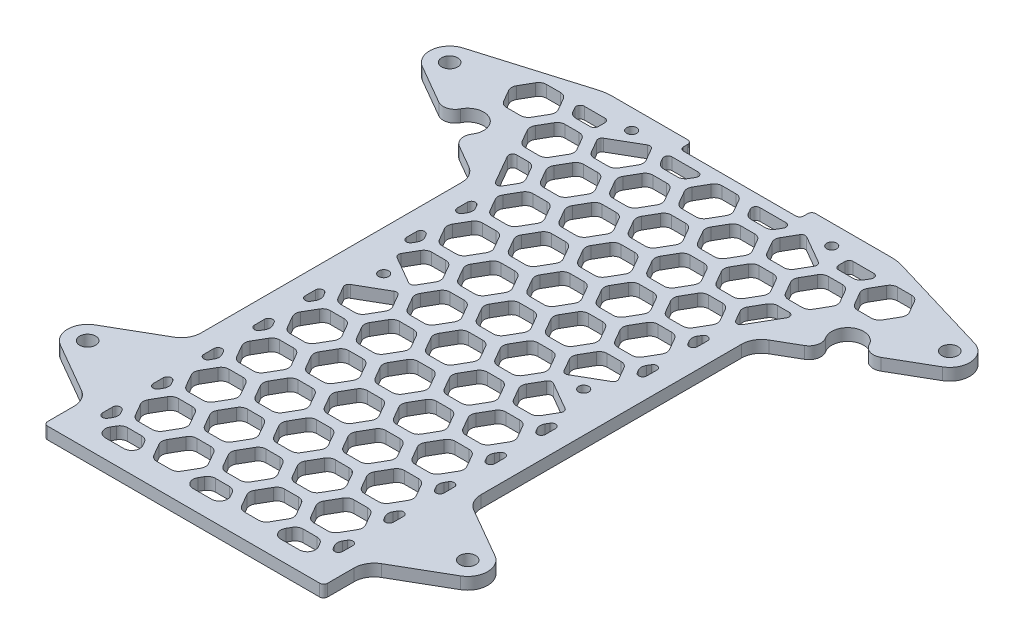
from build123d import *

# Parameters (mm, degrees)
SKETCH_2_R          = 1.25
SKETCH_2_R_2        = 2
EXTRUDE_1_DEPTH     = 3
SKETCH_5_W          = 30
SKETCH_5_H          = 3
CUT_EXTRUDE_4_DEPTH = 153.755523632
FILLET_2_R          = 1
FILLET_1_R          = 2


with BuildPart() as part:
    # 草图2 → 凸台-拉伸1 (new body)
    with BuildSketch(Plane(origin=(0, 0, 0), x_dir=(1, 0, 0), z_dir=(0, 1, 0))):
        with BuildLine():
            Line((-43.151430903, -24.944404268), (-37.5, -28.207259422))
            ThreePointArc((-37.5, -28.207259422), (-35.669872981, -30.037386441), (-35, -32.537386441))
            Line((-35, -32.537386441), (-35, -97.622867597))
            ThreePointArc((-35, -97.622867597), (-35.669872981, -100.122867597), (-37.5, -101.952994616))
            Line((-37.5, -101.952994616), (-50, -109.169872981))
            ThreePointArc((-50, -109.169872981), (-52.5, -113.5), (-50, -117.830127019))
            Line((-50, -117.830127019), (-37.5, -125.047005384))
            ThreePointArc((-37.5, -125.047005384), (-35.669872981, -126.877132403), (-35, -129.377132403))
            Line((-35, -129.377132403), (-35, -137))
            Line((-35, -137), (35, -137))
            Line((35, -137), (35, -129.377132403))
            ThreePointArc((35, -129.377132403), (35.669872981, -126.877132403), (37.5, -125.047005384))
            Line((37.5, -125.047005384), (50, -117.830127019))
            ThreePointArc((50, -117.830127019), (52.5, -113.5), (50, -109.169872981))
            Line((50, -109.169872981), (37.5, -101.952994616))
            ThreePointArc((37.5, -101.952994616), (35.669872981, -100.122867597), (35, -97.622867597))
            Line((35, -97.622867597), (35, -32.537386441))
            ThreePointArc((35, -32.537386441), (35.669872981, -30.037386441), (37.5, -28.207259422))
            Line((37.5, -28.207259422), (43.151430903, -24.944404268))
            ThreePointArc((43.151430903, -24.944404268), (44.570551627, -23.038234264), (44.157960516, -20.697901747))
            ThreePointArc((44.157960516, -20.697901747), (45.5, -15.035898385), (51.07445849, -16.70465978))
            ThreePointArc((51.07445849, -16.70465978), (52.894950347, -18.232140422), (55.255302357, -17.956230826))
            Line((55.255302357, -17.956230826), (65, -12.330127019))
            ThreePointArc((65, -12.330127019), (67.466051679, -7.418337963), (63.931706025, -3.209361435))
            Line((63.931706025, -3.209361435), (37.86341205, 4.581277129))
            ThreePointArc((37.86341205, 4.581277129), (36.44693274, 4.894765568), (35, 5))
            Line((35, 5), (-35, 5))
            ThreePointArc((-35, 5), (-36.44693274, 4.894765568), (-37.86341205, 4.581277129))
            Line((-37.86341205, 4.581277129), (-63.931706025, -3.209361435))
            ThreePointArc((-63.931706025, -3.209361435), (-67.466051679, -7.418337963), (-65, -12.330127019))
            Line((-65, -12.330127019), (-55.255302357, -17.956230826))
            ThreePointArc((-55.255302357, -17.956230826), (-52.894950347, -18.232140422), (-51.07445849, -16.70465978))
            ThreePointArc((-51.07445849, -16.70465978), (-45.5, -15.035898385), (-44.157960516, -20.697901747))
            ThreePointArc((-44.157960516, -20.697901747), (-44.570551627, -23.038234264), (-43.151430903, -24.944404268))
        make_face()
        with Locations(Location((-25, 0, 0), (0, 0, 270))):
            Circle(SKETCH_2_R, mode=Mode.SUBTRACT)
        with Locations(Location((-62.5, -8, 0), (0, 0, 270))):
            Circle(SKETCH_2_R_2, mode=Mode.SUBTRACT)
        with Locations(Location((62.5, -8, 0), (0, 0, 90))):
            Circle(SKETCH_2_R_2, mode=Mode.SUBTRACT)
        with Locations(Location((25, 0, 0), (0, 0, 270))):
            Circle(SKETCH_2_R, mode=Mode.SUBTRACT)
        with Locations(Location((-25, -62, 0), (0, 0, 270))):
            Circle(SKETCH_2_R, mode=Mode.SUBTRACT)
        with Locations(Location((25, -62, 0), (0, 0, 270))):
            Circle(SKETCH_2_R, mode=Mode.SUBTRACT)
        with Locations(Location((-47.5, -113.5, 0), (0, 0, 270))):
            Circle(SKETCH_2_R_2, mode=Mode.SUBTRACT)
        with Locations(Location((47.5, -113.5, 0), (0, 0, 90))):
            Circle(SKETCH_2_R_2, mode=Mode.SUBTRACT)
    extrude(amount=EXTRUDE_1_DEPTH)

    # 草图5 → 切除-拉伸4 (cut, through all)
    with BuildSketch(Plane(origin=(0, 3, 0), x_dir=(1, 0, 0), z_dir=(0, 1, 0))):
        Polygon((-19.052558883, -13.333333333), (-24.826061575, -13.333333333), (-27.712812921, -18.333333333), (-24.826061575, -23.333333333), (-19.052558883, -23.333333333), (-16.165807537, -18.333333333), align=None)
        Polygon((-30.022213998, -19.666666667), (-35.79571669, -19.666666667), (-30.022213998, -29.666666667), (-27.135462652, -24.666666667), align=None)
        with Locations((0, 3.5)):
            Rectangle(SKETCH_5_W, SKETCH_5_H)
        Polygon((2.886751346, -13.333333333), (-2.886751346, -13.333333333), (-5.773502692, -18.333333333), (-2.886751346, -23.333333333), (2.886751346, -23.333333333), (5.773502692, -18.333333333), align=None)
        Polygon((-8.082903769, -19.666666667), (-13.856406461, -19.666666667), (-16.743157806, -24.666666667), (-13.856406461, -29.666666667), (-8.082903769, -29.666666667), (-5.196152423, -24.666666667), align=None)
        Polygon((-8.082903769, -7), (-13.856406461, -7), (-16.743157806, -12), (-13.856406461, -17), (-8.082903769, -17), (-5.196152423, -12), align=None)
        Polygon((2.886751346, -0.666666667), (-2.886751346, -0.666666667), (-5.773502692, -5.666666667), (-2.886751346, -10.666666667), (2.886751346, -10.666666667), (5.773502692, -5.666666667), align=None)
        Polygon((-30.022213998, -7), (-35.79571669, -7), (-38.682468036, -12), (-35.79571669, -17), (-30.022213998, -17), (-27.135462652, -12), align=None)
        Polygon((-27.712812921, -5.666666667), (-24.826061575, -10.666666667), (-19.052558883, -10.666666667), (-16.165807537, -5.666666667), (-19.052558883, -0.666666667), align=None)
        Polygon((-40.991869112, -0.666666667), (-46.765371804, -0.666666667), (-49.65212315, -5.666666667), (-46.765371804, -10.666666667), (-40.991869112, -10.666666667), (-38.105117767, -5.666666667), align=None)
        Polygon((-19.052558883, -38.666666667), (-24.826061575, -38.666666667), (-27.712812921, -43.666666667), (-24.826061575, -48.666666667), (-19.052558883, -48.666666667), (-16.165807537, -43.666666667), align=None)
        Polygon((-30.022213998, -55), (-27.135462652, -50), (-30.022213998, -45), align=None)
        Polygon((-30.022213998, -42.333333333), (-27.135462652, -37.333333333), (-30.022213998, -32.333333333), align=None)
        Polygon((-19.052558883, -26), (-24.826061575, -26), (-27.712812921, -31), (-24.826061575, -36), (-19.052558883, -36), (-16.165807537, -31), align=None)
        Polygon((-27.712812921, -69), (-24.826061575, -74), (-19.052558883, -74), (-16.165807537, -69), (-19.052558883, -64), align=None)
        Polygon((-30.022213998, -80.333333333), (-27.135462652, -75.333333333), (-30.022213998, -70.333333333), align=None)
        Polygon((-19.052558883, -51.333333333), (-24.826061575, -51.333333333), (-27.712812921, -56.333333333), (-19.052558883, -61.333333333), (-16.165807537, -56.333333333), align=None)
        Polygon((-19.052558883, -89.333333333), (-24.826061575, -89.333333333), (-27.712812921, -94.333333333), (-24.826061575, -99.333333333), (-19.052558883, -99.333333333), (-16.165807537, -94.333333333), align=None)
        Polygon((-30.022213998, -105.666666667), (-27.135462652, -100.666666667), (-30.022213998, -95.666666667), align=None)
        Polygon((-30.022213998, -93), (-27.135462652, -88), (-30.022213998, -83), align=None)
        Polygon((-19.052558883, -76.666666667), (-24.826061575, -76.666666667), (-27.712812921, -81.666666667), (-24.826061575, -86.666666667), (-19.052558883, -86.666666667), (-16.165807537, -81.666666667), align=None)
        Polygon((-19.052558883, -114.666666667), (-24.826061575, -114.666666667), (-27.712812921, -119.666666667), (-24.826061575, -124.666666667), (-19.052558883, -124.666666667), (-16.165807537, -119.666666667), align=None)
        Polygon((-30.022213998, -131), (-27.135462652, -126), (-30.022213998, -121), align=None)
        Polygon((-30.022213998, -118.333333333), (-27.135462652, -113.333333333), (-30.022213998, -108.333333333), align=None)
        Polygon((-19.052558883, -102), (-24.826061575, -102), (-27.712812921, -107), (-24.826061575, -112), (-19.052558883, -112), (-16.165807537, -107), align=None)
        Polygon((-19.052558883, -127.333333333), (-24.826061575, -127.333333333), (-27.712812921, -132.333333333), (-16.165807537, -132.333333333), align=None)
        Polygon((2.886751346, -38.666666667), (-2.886751346, -38.666666667), (-5.773502692, -43.666666667), (-2.886751346, -48.666666667), (2.886751346, -48.666666667), (5.773502692, -43.666666667), align=None)
        Polygon((-8.082903769, -45), (-13.856406461, -45), (-16.743157806, -50), (-13.856406461, -55), (-8.082903769, -55), (-5.196152423, -50), align=None)
        Polygon((-8.082903769, -32.333333333), (-13.856406461, -32.333333333), (-16.743157806, -37.333333333), (-13.856406461, -42.333333333), (-8.082903769, -42.333333333), (-5.196152423, -37.333333333), align=None)
        Polygon((2.886751346, -26), (-2.886751346, -26), (-5.773502692, -31), (-2.886751346, -36), (2.886751346, -36), (5.773502692, -31), align=None)
        Polygon((2.886751346, -64), (-2.886751346, -64), (-5.773502692, -69), (-2.886751346, -74), (2.886751346, -74), (5.773502692, -69), align=None)
        Polygon((-8.082903769, -70.333333333), (-13.856406461, -70.333333333), (-16.743157806, -75.333333333), (-13.856406461, -80.333333333), (-8.082903769, -80.333333333), (-5.196152423, -75.333333333), align=None)
        Polygon((-8.082903769, -57.666666667), (-13.856406461, -57.666666667), (-16.743157806, -62.666666667), (-13.856406461, -67.666666667), (-8.082903769, -67.666666667), (-5.196152423, -62.666666667), align=None)
        Polygon((2.886751346, -51.333333333), (-2.886751346, -51.333333333), (-5.773502692, -56.333333333), (-2.886751346, -61.333333333), (2.886751346, -61.333333333), (5.773502692, -56.333333333), align=None)
        Polygon((2.886751346, -89.333333333), (-2.886751346, -89.333333333), (-5.773502692, -94.333333333), (-2.886751346, -99.333333333), (2.886751346, -99.333333333), (5.773502692, -94.333333333), align=None)
        Polygon((-8.082903769, -95.666666667), (-13.856406461, -95.666666667), (-16.743157806, -100.666666667), (-13.856406461, -105.666666667), (-8.082903769, -105.666666667), (-5.196152423, -100.666666667), align=None)
        Polygon((-8.082903769, -83), (-13.856406461, -83), (-16.743157806, -88), (-13.856406461, -93), (-8.082903769, -93), (-5.196152423, -88), align=None)
        Polygon((2.886751346, -76.666666667), (-2.886751346, -76.666666667), (-5.773502692, -81.666666667), (-2.886751346, -86.666666667), (2.886751346, -86.666666667), (5.773502692, -81.666666667), align=None)
        Polygon((2.886751346, -114.666666667), (-2.886751346, -114.666666667), (-5.773502692, -119.666666667), (-2.886751346, -124.666666667), (2.886751346, -124.666666667), (5.773502692, -119.666666667), align=None)
        Polygon((-8.082903769, -121), (-13.856406461, -121), (-16.743157806, -126), (-13.856406461, -131), (-8.082903769, -131), (-5.196152423, -126), align=None)
        Polygon((-8.082903769, -108.333333333), (-13.856406461, -108.333333333), (-16.743157806, -113.333333333), (-13.856406461, -118.333333333), (-8.082903769, -118.333333333), (-5.196152423, -113.333333333), align=None)
        Polygon((2.886751346, -102), (-2.886751346, -102), (-5.773502692, -107), (-2.886751346, -112), (2.886751346, -112), (5.773502692, -107), align=None)
        Polygon((2.886751346, -127.333333333), (-2.886751346, -127.333333333), (-5.773502692, -132.333333333), (5.773502692, -132.333333333), align=None)
        Polygon((-15.973357448, -0.666666667), (-13.856406461, -4.333333333), (-8.082903769, -4.333333333), (-5.965952782, -0.666666667), align=None)
        Polygon((-37.912667677, -0.666666667), (-30.022213998, -0.666666667), (-30.022213998, -4.333333333), (-35.79571669, -4.333333333), align=None)
    cut_extrude_4 = extrude(amount=-CUT_EXTRUDE_4_DEPTH, mode=Mode.SUBTRACT)

    # 镜向1: 切除-拉伸4 across plane
    add(cut_extrude_4.mirror(Plane(origin=(0, 0, 0), x_dir=(0, 0, 1), z_dir=(1, 0, 0))), mode=Mode.SUBTRACT)

    # 圆角2
    fillet_2_edges = [part.edges().sort_by_distance(p)[0] for p in [
        (30.022213998, 1.5, 121),
        (30.022213998, 1.5, 131),
        (30.022213998, 1.5, 83),
        (30.022213998, 1.5, 93),
        (30.022213998, 1.5, 95.666666667),
        (30.022213998, 1.5, 105.666666667),
        (27.712812921, 1.5, 56.333333333),
        (19.052558883, 1.5, 61.333333333),
        (30.022213998, 1.5, 70.333333333),
        (30.022213998, 1.5, 80.333333333),
        (30.022213998, 1.5, 108.333333333),
        (30.022213998, 1.5, 118.333333333),
        (35.79571669, 1.5, 19.666666667),
        (30.022213998, 1.5, 29.666666667),
        (30.022213998, 1.5, 45),
        (30.022213998, 1.5, 55),
        (30.022213998, 1.5, 32.333333333),
        (30.022213998, 1.5, 42.333333333),
        (19.052558883, 1.5, 64),
        (27.712812921, 1.5, 69),
        (19.052558883, 1.5, 0.666666667),
        (27.712812921, 1.5, 5.666666667),
        (37.912667677, 1.5, 0.666666667),
        (30.022213998, 1.5, 4.333333333),
        (30.022213998, 1.5, 0.666666667),
        (5.965952782, 1.5, 0.666666667),
        (15.973357448, 1.5, 0.666666667),
        (-30.022213998, 1.5, 131),
        (-30.022213998, 1.5, 121),
        (-30.022213998, 1.5, 93),
        (-30.022213998, 1.5, 83),
        (-30.022213998, 1.5, 105.666666667),
        (-30.022213998, 1.5, 95.666666667),
        (-19.052558883, 1.5, 61.333333333),
        (-27.712812921, 1.5, 56.333333333),
        (-30.022213998, 1.5, 80.333333333),
        (-30.022213998, 1.5, 70.333333333),
        (-30.022213998, 1.5, 118.333333333),
        (-30.022213998, 1.5, 108.333333333),
        (-30.022213998, 1.5, 29.666666667),
        (-35.79571669, 1.5, 19.666666667),
        (-15, 1.5, -2),
        (-15, 1.5, -5),
        (15, 1.5, -5),
        (15, 1.5, -2),
        (-30.022213998, 1.5, 55),
        (-30.022213998, 1.5, 45),
        (-30.022213998, 1.5, 42.333333333),
        (-30.022213998, 1.5, 32.333333333),
        (35, 1.5, 137),
        (-27.712812921, 1.5, 69),
        (-19.052558883, 1.5, 64),
        (-35, 1.5, 137),
        (-27.712812921, 1.5, 5.666666667),
        (-19.052558883, 1.5, 0.666666667),
        (-37.912667677, 1.5, 0.666666667),
        (-30.022213998, 1.5, 0.666666667),
        (-30.022213998, 1.5, 4.333333333),
        (-15.973357448, 1.5, 0.666666667),
        (-5.965952782, 1.5, 0.666666667),
    ]]
    fillet(fillet_2_edges, radius=FILLET_2_R)

    # 圆角1
    fillet_1_edges = [part.edges().sort_by_distance(p)[0] for p in [
        (16.165807537, 1.5, 119.666666667),
        (19.052558883, 1.5, 114.666666667),
        (24.826061575, 1.5, 114.666666667),
        (27.712812921, 1.5, 119.666666667),
        (24.826061575, 1.5, 124.666666667),
        (19.052558883, 1.5, 124.666666667),
        (27.135462652, 1.5, 126),
        (27.135462652, 1.5, 88),
        (16.165807537, 1.5, 81.666666667),
        (19.052558883, 1.5, 76.666666667),
        (24.826061575, 1.5, 76.666666667),
        (27.712812921, 1.5, 81.666666667),
        (24.826061575, 1.5, 86.666666667),
        (19.052558883, 1.5, 86.666666667),
        (16.165807537, 1.5, 94.333333333),
        (19.052558883, 1.5, 89.333333333),
        (24.826061575, 1.5, 89.333333333),
        (27.712812921, 1.5, 94.333333333),
        (24.826061575, 1.5, 99.333333333),
        (19.052558883, 1.5, 99.333333333),
        (27.135462652, 1.5, 100.666666667),
        (16.165807537, 1.5, 56.333333333),
        (19.052558883, 1.5, 51.333333333),
        (24.826061575, 1.5, 51.333333333),
        (27.135462652, 1.5, 75.333333333),
        (5.196152423, 1.5, 50),
        (8.082903769, 1.5, 45),
        (13.856406461, 1.5, 45),
        (16.743157806, 1.5, 50),
        (13.856406461, 1.5, 55),
        (8.082903769, 1.5, 55),
        (5.196152423, 1.5, 37.333333333),
        (8.082903769, 1.5, 32.333333333),
        (13.856406461, 1.5, 32.333333333),
        (16.743157806, 1.5, 37.333333333),
        (13.856406461, 1.5, 42.333333333),
        (8.082903769, 1.5, 42.333333333),
        (16.165807537, 1.5, 107),
        (19.052558883, 1.5, 102),
        (24.826061575, 1.5, 102),
        (27.712812921, 1.5, 107),
        (24.826061575, 1.5, 112),
        (19.052558883, 1.5, 112),
        (27.135462652, 1.5, 113.333333333),
        (16.165807537, 1.5, 132.333333333),
        (19.052558883, 1.5, 127.333333333),
        (24.826061575, 1.5, 127.333333333),
        (27.712812921, 1.5, 132.333333333),
        (27.135462652, 1.5, 12),
        (30.022213998, 1.5, 7),
        (35.79571669, 1.5, 7),
        (38.682468036, 1.5, 12),
        (35.79571669, 1.5, 17),
        (30.022213998, 1.5, 17),
        (27.135462652, 1.5, 24.666666667),
        (30.022213998, 1.5, 19.666666667),
        (5.196152423, 1.5, 12),
        (8.082903769, 1.5, 7),
        (13.856406461, 1.5, 7),
        (16.743157806, 1.5, 12),
        (13.856406461, 1.5, 17),
        (8.082903769, 1.5, 17),
        (16.165807537, 1.5, 18.333333333),
        (19.052558883, 1.5, 13.333333333),
        (24.826061575, 1.5, 13.333333333),
        (27.712812921, 1.5, 18.333333333),
        (24.826061575, 1.5, 23.333333333),
        (19.052558883, 1.5, 23.333333333),
        (5.196152423, 1.5, 24.666666667),
        (8.082903769, 1.5, 19.666666667),
        (13.856406461, 1.5, 19.666666667),
        (16.743157806, 1.5, 24.666666667),
        (13.856406461, 1.5, 29.666666667),
        (8.082903769, 1.5, 29.666666667),
        (27.135462652, 1.5, 50),
        (27.135462652, 1.5, 37.333333333),
        (16.165807537, 1.5, 31),
        (19.052558883, 1.5, 26),
        (24.826061575, 1.5, 26),
        (27.712812921, 1.5, 31),
        (24.826061575, 1.5, 36),
        (19.052558883, 1.5, 36),
        (24.826061575, 1.5, 74),
        (19.052558883, 1.5, 74),
        (16.165807537, 1.5, 69),
        (24.826061575, 1.5, 10.666666667),
        (19.052558883, 1.5, 10.666666667),
        (16.165807537, 1.5, 5.666666667),
        (35.79571669, 1.5, 4.333333333),
        (38.105117767, 1.5, 5.666666667),
        (40.991869112, 1.5, 0.666666667),
        (46.765371804, 1.5, 0.666666667),
        (49.65212315, 1.5, 5.666666667),
        (46.765371804, 1.5, 10.666666667),
        (40.991869112, 1.5, 10.666666667),
        (16.165807537, 1.5, 43.666666667),
        (19.052558883, 1.5, 38.666666667),
        (24.826061575, 1.5, 38.666666667),
        (27.712812921, 1.5, 43.666666667),
        (24.826061575, 1.5, 48.666666667),
        (19.052558883, 1.5, 48.666666667),
        (5.196152423, 1.5, 126),
        (8.082903769, 1.5, 121),
        (13.856406461, 1.5, 121),
        (16.743157806, 1.5, 126),
        (13.856406461, 1.5, 131),
        (8.082903769, 1.5, 131),
        (5.196152423, 1.5, 113.333333333),
        (8.082903769, 1.5, 108.333333333),
        (13.856406461, 1.5, 108.333333333),
        (16.743157806, 1.5, 113.333333333),
        (13.856406461, 1.5, 118.333333333),
        (8.082903769, 1.5, 118.333333333),
        (5.196152423, 1.5, 62.666666667),
        (8.082903769, 1.5, 57.666666667),
        (13.856406461, 1.5, 57.666666667),
        (16.743157806, 1.5, 62.666666667),
        (13.856406461, 1.5, 67.666666667),
        (8.082903769, 1.5, 67.666666667),
        (5.196152423, 1.5, 75.333333333),
        (8.082903769, 1.5, 70.333333333),
        (13.856406461, 1.5, 70.333333333),
        (16.743157806, 1.5, 75.333333333),
        (13.856406461, 1.5, 80.333333333),
        (8.082903769, 1.5, 80.333333333),
        (5.196152423, 1.5, 88),
        (8.082903769, 1.5, 83),
        (13.856406461, 1.5, 83),
        (16.743157806, 1.5, 88),
        (13.856406461, 1.5, 93),
        (8.082903769, 1.5, 93),
        (5.196152423, 1.5, 100.666666667),
        (8.082903769, 1.5, 95.666666667),
        (13.856406461, 1.5, 95.666666667),
        (16.743157806, 1.5, 100.666666667),
        (13.856406461, 1.5, 105.666666667),
        (8.082903769, 1.5, 105.666666667),
        (13.856406461, 1.5, 4.333333333),
        (8.082903769, 1.5, 4.333333333),
        (-19.052558883, 1.5, 114.666666667),
        (-16.165807537, 1.5, 119.666666667),
        (-19.052558883, 1.5, 124.666666667),
        (-24.826061575, 1.5, 124.666666667),
        (-27.712812921, 1.5, 119.666666667),
        (-24.826061575, 1.5, 114.666666667),
        (-27.135462652, 1.5, 126),
        (-27.135462652, 1.5, 88),
        (-19.052558883, 1.5, 76.666666667),
        (-16.165807537, 1.5, 81.666666667),
        (-19.052558883, 1.5, 86.666666667),
        (-24.826061575, 1.5, 86.666666667),
        (-27.712812921, 1.5, 81.666666667),
        (-24.826061575, 1.5, 76.666666667),
        (-19.052558883, 1.5, 89.333333333),
        (-16.165807537, 1.5, 94.333333333),
        (-19.052558883, 1.5, 99.333333333),
        (-24.826061575, 1.5, 99.333333333),
        (-27.712812921, 1.5, 94.333333333),
        (-24.826061575, 1.5, 89.333333333),
        (-27.135462652, 1.5, 100.666666667),
        (-19.052558883, 1.5, 51.333333333),
        (-16.165807537, 1.5, 56.333333333),
        (-24.826061575, 1.5, 51.333333333),
        (-27.135462652, 1.5, 75.333333333),
        (-8.082903769, 1.5, 45),
        (-5.196152423, 1.5, 50),
        (-8.082903769, 1.5, 55),
        (-13.856406461, 1.5, 55),
        (-16.743157806, 1.5, 50),
        (-13.856406461, 1.5, 45),
        (-8.082903769, 1.5, 32.333333333),
        (-5.196152423, 1.5, 37.333333333),
        (-8.082903769, 1.5, 42.333333333),
        (-13.856406461, 1.5, 42.333333333),
        (-16.743157806, 1.5, 37.333333333),
        (-13.856406461, 1.5, 32.333333333),
        (2.886751346, 1.5, 26),
        (5.773502692, 1.5, 31),
        (2.886751346, 1.5, 36),
        (-2.886751346, 1.5, 36),
        (-5.773502692, 1.5, 31),
        (-2.886751346, 1.5, 26),
        (2.886751346, 1.5, 64),
        (5.773502692, 1.5, 69),
        (2.886751346, 1.5, 74),
        (-2.886751346, 1.5, 74),
        (-5.773502692, 1.5, 69),
        (-2.886751346, 1.5, 64),
        (-19.052558883, 1.5, 102),
        (-16.165807537, 1.5, 107),
        (-19.052558883, 1.5, 112),
        (-24.826061575, 1.5, 112),
        (-27.712812921, 1.5, 107),
        (-24.826061575, 1.5, 102),
        (-27.135462652, 1.5, 113.333333333),
        (-19.052558883, 1.5, 127.333333333),
        (-16.165807537, 1.5, 132.333333333),
        (-27.712812921, 1.5, 132.333333333),
        (-24.826061575, 1.5, 127.333333333),
        (2.886751346, 1.5, 38.666666667),
        (5.773502692, 1.5, 43.666666667),
        (2.886751346, 1.5, 48.666666667),
        (-2.886751346, 1.5, 48.666666667),
        (-5.773502692, 1.5, 43.666666667),
        (-2.886751346, 1.5, 38.666666667),
        (-30.022213998, 1.5, 7),
        (-27.135462652, 1.5, 12),
        (-30.022213998, 1.5, 17),
        (-35.79571669, 1.5, 17),
        (-38.682468036, 1.5, 12),
        (-35.79571669, 1.5, 7),
        (-30.022213998, 1.5, 19.666666667),
        (-27.135462652, 1.5, 24.666666667),
        (-8.082903769, 1.5, 7),
        (-5.196152423, 1.5, 12),
        (-8.082903769, 1.5, 17),
        (-13.856406461, 1.5, 17),
        (-16.743157806, 1.5, 12),
        (-13.856406461, 1.5, 7),
        (2.886751346, 1.5, 0.666666667),
        (5.773502692, 1.5, 5.666666667),
        (2.886751346, 1.5, 10.666666667),
        (-2.886751346, 1.5, 10.666666667),
        (-5.773502692, 1.5, 5.666666667),
        (-2.886751346, 1.5, 0.666666667),
        (-19.052558883, 1.5, 13.333333333),
        (-16.165807537, 1.5, 18.333333333),
        (-19.052558883, 1.5, 23.333333333),
        (-24.826061575, 1.5, 23.333333333),
        (-27.712812921, 1.5, 18.333333333),
        (-24.826061575, 1.5, 13.333333333),
        (-8.082903769, 1.5, 19.666666667),
        (-5.196152423, 1.5, 24.666666667),
        (-8.082903769, 1.5, 29.666666667),
        (-13.856406461, 1.5, 29.666666667),
        (-16.743157806, 1.5, 24.666666667),
        (-13.856406461, 1.5, 19.666666667),
        (2.886751346, 1.5, 13.333333333),
        (5.773502692, 1.5, 18.333333333),
        (2.886751346, 1.5, 23.333333333),
        (-2.886751346, 1.5, 23.333333333),
        (-5.773502692, 1.5, 18.333333333),
        (-2.886751346, 1.5, 13.333333333),
        (-27.135462652, 1.5, 50),
        (-27.135462652, 1.5, 37.333333333),
        (-19.052558883, 1.5, 26),
        (-16.165807537, 1.5, 31),
        (-19.052558883, 1.5, 36),
        (-24.826061575, 1.5, 36),
        (-27.712812921, 1.5, 31),
        (-24.826061575, 1.5, 26),
        (-16.165807537, 1.5, 69),
        (-19.052558883, 1.5, 74),
        (-24.826061575, 1.5, 74),
        (-16.165807537, 1.5, 5.666666667),
        (-19.052558883, 1.5, 10.666666667),
        (-24.826061575, 1.5, 10.666666667),
        (-35.79571669, 1.5, 4.333333333),
        (-40.991869112, 1.5, 0.666666667),
        (-38.105117767, 1.5, 5.666666667),
        (-40.991869112, 1.5, 10.666666667),
        (-46.765371804, 1.5, 10.666666667),
        (-49.65212315, 1.5, 5.666666667),
        (-46.765371804, 1.5, 0.666666667),
        (-19.052558883, 1.5, 38.666666667),
        (-16.165807537, 1.5, 43.666666667),
        (-19.052558883, 1.5, 48.666666667),
        (-24.826061575, 1.5, 48.666666667),
        (-27.712812921, 1.5, 43.666666667),
        (-24.826061575, 1.5, 38.666666667),
        (-8.082903769, 1.5, 121),
        (-5.196152423, 1.5, 126),
        (-8.082903769, 1.5, 131),
        (-13.856406461, 1.5, 131),
        (-16.743157806, 1.5, 126),
        (-13.856406461, 1.5, 121),
        (-8.082903769, 1.5, 108.333333333),
        (-5.196152423, 1.5, 113.333333333),
        (-8.082903769, 1.5, 118.333333333),
        (-13.856406461, 1.5, 118.333333333),
        (-16.743157806, 1.5, 113.333333333),
        (-13.856406461, 1.5, 108.333333333),
        (2.886751346, 1.5, 102),
        (5.773502692, 1.5, 107),
        (2.886751346, 1.5, 112),
        (-2.886751346, 1.5, 112),
        (-5.773502692, 1.5, 107),
        (-2.886751346, 1.5, 102),
        (2.886751346, 1.5, 127.333333333),
        (5.773502692, 1.5, 132.333333333),
        (-5.773502692, 1.5, 132.333333333),
        (-2.886751346, 1.5, 127.333333333),
        (2.886751346, 1.5, 89.333333333),
        (5.773502692, 1.5, 94.333333333),
        (2.886751346, 1.5, 99.333333333),
        (-2.886751346, 1.5, 99.333333333),
        (-5.773502692, 1.5, 94.333333333),
        (-2.886751346, 1.5, 89.333333333),
        (2.886751346, 1.5, 51.333333333),
        (5.773502692, 1.5, 56.333333333),
        (2.886751346, 1.5, 61.333333333),
        (-2.886751346, 1.5, 61.333333333),
        (-5.773502692, 1.5, 56.333333333),
        (-2.886751346, 1.5, 51.333333333),
        (-8.082903769, 1.5, 57.666666667),
        (-5.196152423, 1.5, 62.666666667),
        (-8.082903769, 1.5, 67.666666667),
        (-13.856406461, 1.5, 67.666666667),
        (-16.743157806, 1.5, 62.666666667),
        (-13.856406461, 1.5, 57.666666667),
        (-8.082903769, 1.5, 70.333333333),
        (-5.196152423, 1.5, 75.333333333),
        (-8.082903769, 1.5, 80.333333333),
        (-13.856406461, 1.5, 80.333333333),
        (-16.743157806, 1.5, 75.333333333),
        (-13.856406461, 1.5, 70.333333333),
        (2.886751346, 1.5, 114.666666667),
        (5.773502692, 1.5, 119.666666667),
        (2.886751346, 1.5, 124.666666667),
        (-2.886751346, 1.5, 124.666666667),
        (-5.773502692, 1.5, 119.666666667),
        (-2.886751346, 1.5, 114.666666667),
        (2.886751346, 1.5, 76.666666667),
        (5.773502692, 1.5, 81.666666667),
        (2.886751346, 1.5, 86.666666667),
        (-2.886751346, 1.5, 86.666666667),
        (-5.773502692, 1.5, 81.666666667),
        (-2.886751346, 1.5, 76.666666667),
        (-8.082903769, 1.5, 83),
        (-5.196152423, 1.5, 88),
        (-8.082903769, 1.5, 93),
        (-13.856406461, 1.5, 93),
        (-16.743157806, 1.5, 88),
        (-13.856406461, 1.5, 83),
        (-8.082903769, 1.5, 95.666666667),
        (-5.196152423, 1.5, 100.666666667),
        (-8.082903769, 1.5, 105.666666667),
        (-13.856406461, 1.5, 105.666666667),
        (-16.743157806, 1.5, 100.666666667),
        (-13.856406461, 1.5, 95.666666667),
        (-8.082903769, 1.5, 4.333333333),
        (-13.856406461, 1.5, 4.333333333),
    ]]
    fillet(fillet_1_edges, radius=FILLET_1_R)


solid = part.part
